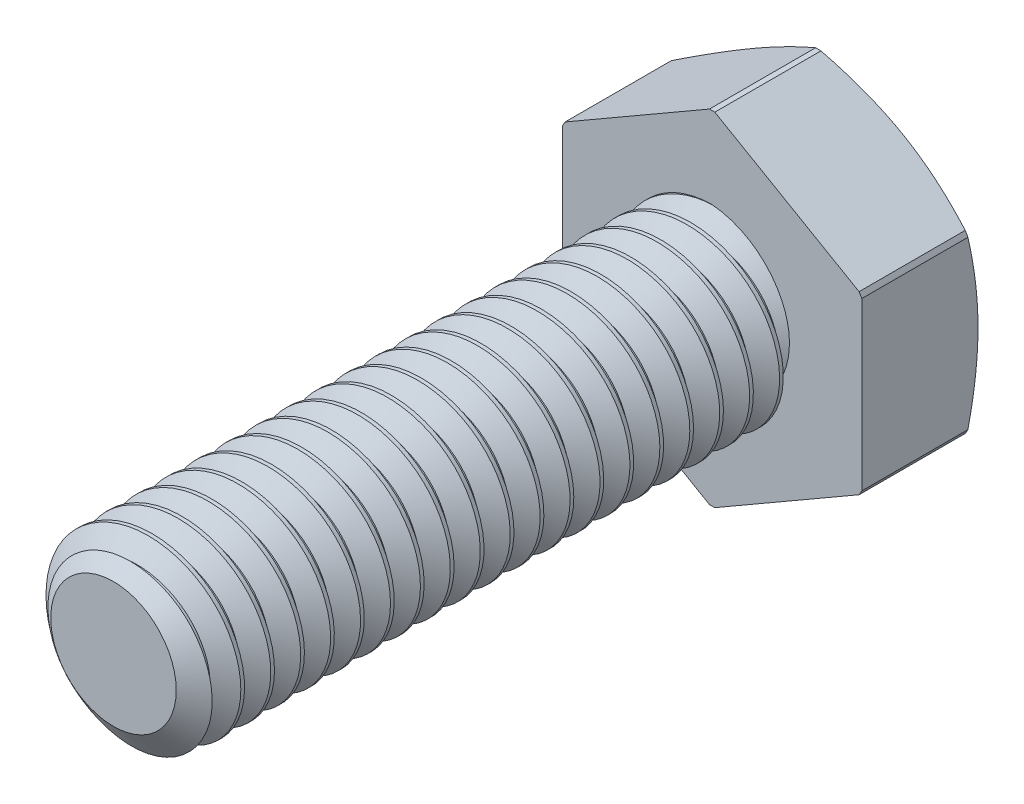
from build123d import *

# Parameters (mm, degrees)
SKETCH1_R        = 3
EXTRUDE1_DEPTH   = 20
CUT_SWEEP1_PITCH = 1
EXTRUDE2_DEPTH   = 4


with BuildPart() as part:
    # Sketch1 → Extrude1 (new body)
    with BuildSketch(Plane.XY):
        Circle(SKETCH1_R)
    extrude(amount=-EXTRUDE1_DEPTH)

    # Cut-Sweep1: the profile of Sketch3 profile screwed along a right-hand helix of 21 turns, 6 arcs to a turn; built about Z, then put on its axis
    cut_sweep1_z = Axis((0, 0, 0), (0, 0, 1))
    cut_sweep1_corners = [(3.0003, 0, -0.875173205), (2.350480947, 0, -0.5), (2.350480947, 0, -0.375), (3.0003, 0, 0.000173205)]
    with BuildLine(mode=Mode.PRIVATE) as cut_sweep1_profile:
        Line(cut_sweep1_corners[0], cut_sweep1_corners[1])
        Line(cut_sweep1_corners[1], cut_sweep1_corners[2])
        Line(cut_sweep1_corners[2], cut_sweep1_corners[3])
        Line(cut_sweep1_corners[3], cut_sweep1_corners[0])
    cut_sweep1_cap = Face(cut_sweep1_profile.wire())
    cut_sweep1_turn_angles = [0, 30, 60, 90, 120, 150, 180, 210, 240, 270, 300, 330, 360]
    cut_sweep1_turn_weights = [1, 0.8660254037844387, 1, 0.8660254037844387, 1, 0.8660254037844387, 1, 0.8660254037844387, 1, 0.8660254037844387, 1, 0.8660254037844387, 1]
    cut_sweep1_turn_rails = [Edge.make_bspline([Vector(p[0], p[1], 0).rotate(cut_sweep1_z, cut_sweep1_turn_angles[k]) / cut_sweep1_turn_weights[k] + Vector(0, 0, p[2] + CUT_SWEEP1_PITCH * cut_sweep1_turn_angles[k] / 360) for k in range(13)], [0, 0, 0, 1, 1, 2, 2, 3, 3, 4, 4, 5, 5, 6, 6, 6], 2, cut_sweep1_turn_weights) for p in cut_sweep1_corners]
    cut_sweep1_turn_sides = [Face.make_surface_from_curves(cut_sweep1_turn_rails[p[0]], cut_sweep1_turn_rails[p[1]]) for p in [(0, 1), (1, 2), (2, 3), (3, 0)]]
    cut_sweep1 = Plane(origin=(0, 0, 0), x_dir=(0, 1, 0), z_dir=(0, 0, -1)) * Solid(Shell([*[p.moved(Location((0, 0, CUT_SWEEP1_PITCH * i))) for i in range(21) for p in cut_sweep1_turn_sides], cut_sweep1_cap, cut_sweep1_cap.rotate(cut_sweep1_z, 7560).moved(Location((0, 0, CUT_SWEEP1_PITCH * 7560 / 360)))]))
    add(cut_sweep1, mode=Mode.SUBTRACT)

    # Sketch4 → Cut-Revolve1 (revolve, cut)
    with BuildSketch(Plane(origin=(0, 0, 0), x_dir=(0, 0, -1), z_dir=(1, 0, 0)), mode=Mode.PRIVATE) as cut_revolve1_sk:
        Polygon((0.632650852, 3), (0, 2.096480947), (0, 3), align=None)
    revolve(cut_revolve1_sk.sketch.rotate(Axis((0, 0, 0), (0, 0, -1)), 244.349292568), axis=Axis((0, 0, 0), (0, 0, -1)), mode=Mode.SUBTRACT)

    # Sketch6 → Extrude2 (add)
    with BuildSketch(Plane(origin=(0, 0, -20), x_dir=(-1, 0, 0), z_dir=(0, 0, -1))):
        Polygon((0, 5.773502692), (-5, 2.886751346), (-5, -2.886751346), (0, -5.773502692), (5, -2.886751346), (5, 2.886751346), align=None)
    extrude(amount=EXTRUDE2_DEPTH)

    # Sketch10 → Cut-Revolve2 (revolve, cut)
    with BuildSketch(Plane(origin=(0, 0, 0), x_dir=(0, 0, -1), z_dir=(1, 0, 0)), mode=Mode.PRIVATE) as cut_revolve2_sk:
        Polygon((24, 4.75), (23.546596212, 5.722327562), (20, 5.722327562), (20, 5.773502692), (24, 5.773502692), align=None)
    revolve(cut_revolve2_sk.sketch.rotate(Axis((0, 0, 0), (0, 0, -1)), 90), axis=Axis((0, 0, 0), (0, 0, -1)), mode=Mode.SUBTRACT)


solid = part.part
